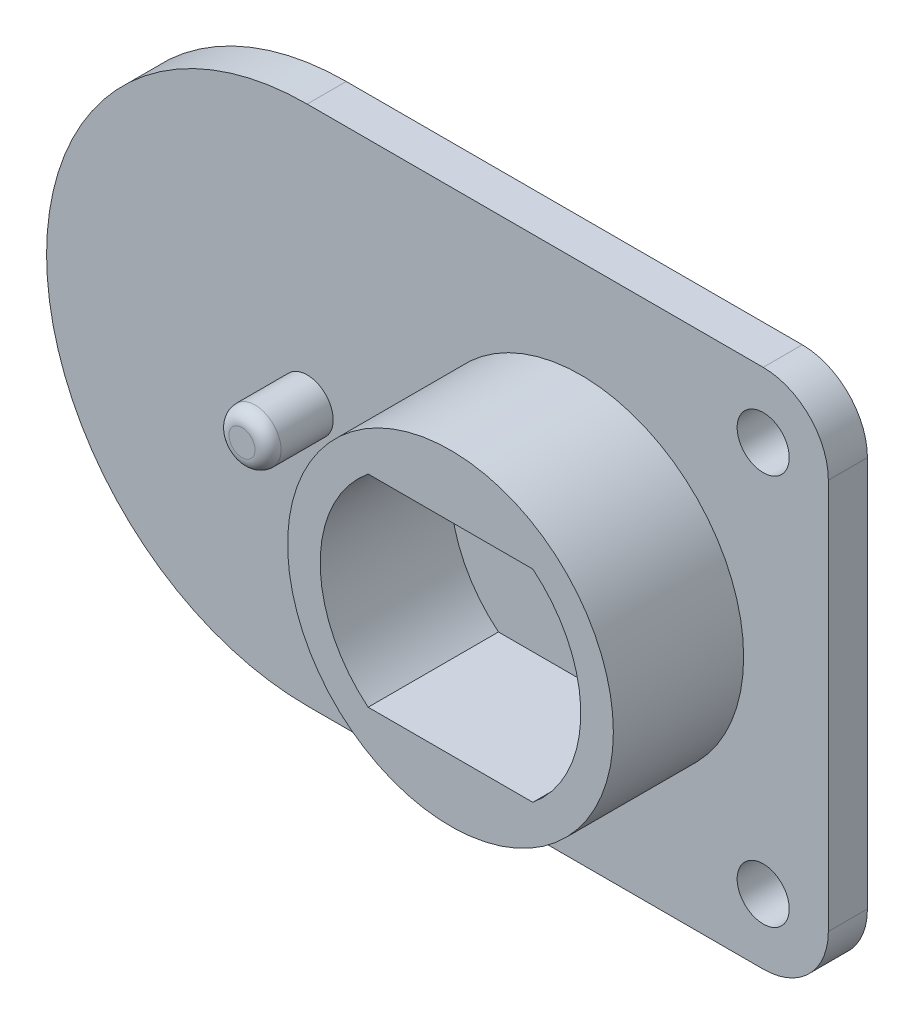
from build123d import *

# Parameters (mm, degrees)
SKIZZE1_R                       = 1.5
SKIZZE1_R_2                     = 1
SKIZZE1_R_3                     = 2
AUFSATZ_LINEAR_AUSTRAGEN1_DEPTH = 3
VERRUNDUNG1_R                   = 5
SKIZZE2_R                       = 12.5
AUFSATZ_LINEAR_AUSTRAGEN2_DEPTH = 10
SKIZZE3_R                       = 2
AUFSATZ_LINEAR_AUSTRAGEN3_DEPTH = 5
VERRUNDUNG2_R                   = 1


with BuildPart() as part:
    # Skizze1 → Aufsatz-Linear austragen1 (new body)
    with BuildSketch(Plane.XY):
        with BuildLine():
            ThreePointArc((0, 20), (-20, 0), (0, -20))
            Line((0, -20), (40, -20))
            Line((40, -20), (40, 20))
            Line((40, 20), (0, 20))
        make_face()
        with Locations((21, 0)):
            Circle(SKIZZE1_R, mode=Mode.SUBTRACT)
        Circle(SKIZZE1_R_2, mode=Mode.SUBTRACT)
        with Locations((35, 15)):
            Circle(SKIZZE1_R_3, mode=Mode.SUBTRACT)
        with Locations((35, -15)):
            Circle(SKIZZE1_R_3, mode=Mode.SUBTRACT)
    extrude(amount=AUFSATZ_LINEAR_AUSTRAGEN1_DEPTH)

    # Verrundung1
    verrundung1_edges = [part.edges().sort_by_distance(p)[0] for p in [
        (40, -20, 1.5),
        (40, 20, 1.5),
    ]]
    fillet(verrundung1_edges, radius=VERRUNDUNG1_R)

    # Skizze2 → Aufsatz-Linear austragen2 (add)
    with BuildSketch(Plane.XY.offset(3)):
        with Locations((21, 0)):
            Circle(SKIZZE2_R)
        with BuildLine():
            ThreePointArc((27.31961233, 7.75), (31, 0), (27.31961233, -7.75))
            Line((27.31961233, -7.75), (14.68038767, -7.75))
            ThreePointArc((14.68038767, -7.75), (11, 0), (14.68038767, 7.75))
            Line((14.68038767, 7.75), (27.31961233, 7.75))
        make_face(mode=Mode.SUBTRACT)
    extrude(amount=AUFSATZ_LINEAR_AUSTRAGEN2_DEPTH)

    # Skizze3 → Aufsatz-Linear austragen3 (add)
    with BuildSketch(Plane.XY.offset(3)):
        Circle(SKIZZE3_R)
    extrude(amount=AUFSATZ_LINEAR_AUSTRAGEN3_DEPTH)

    # Verrundung2
    verrundung2_edges = [part.edges().sort_by_distance(p)[0] for p in [
        (-2, 0, 8),
    ]]
    fillet(verrundung2_edges, radius=VERRUNDUNG2_R)


solid = part.part
